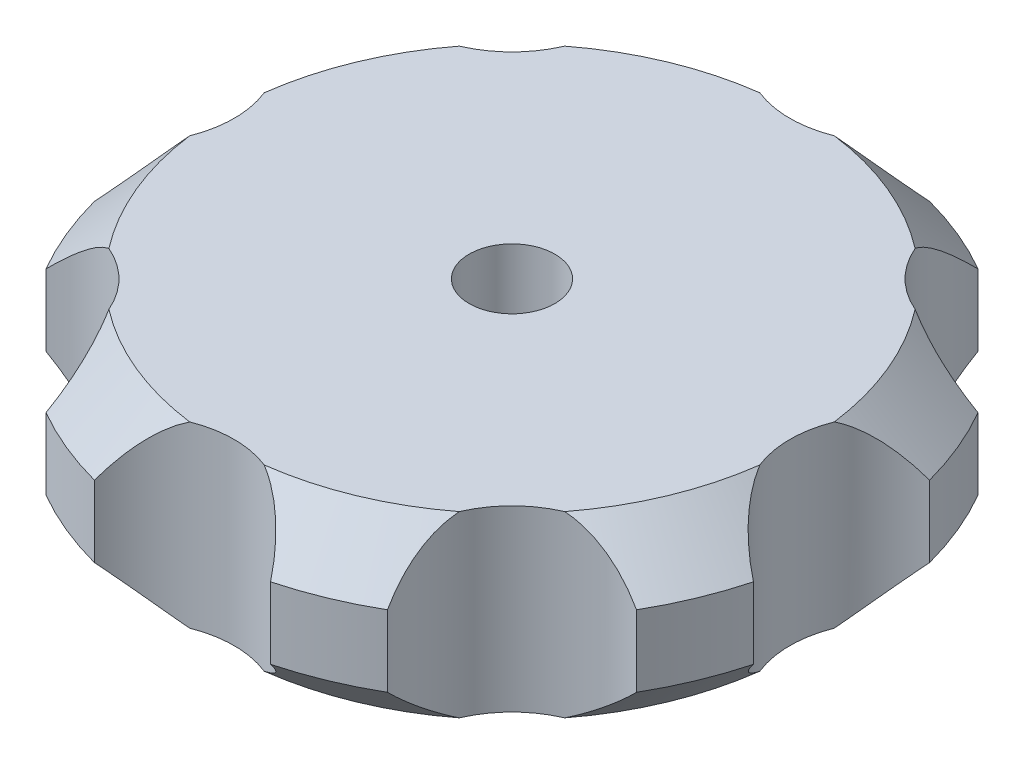
from build123d import *

# Parameters (mm, degrees)
BOSS_EXTRUDE1_DEPTH  = 10
CHAMFER1_SIZE        = 3
M4_CLEARANCE_HOLE1_D = 4.8


with BuildPart() as part:
    # Sketch1 → Boss-Extrude1 (new body)
    with BuildSketch(Plane(origin=(0, 0, 0), x_dir=(1, 0, 0), z_dir=(0, 1, 0))):
        with BuildLine():
            ThreePointArc((4.929173178, -18.444040543), (0, -15.55551692), (-4.929173178, -18.444040543))
            ThreePointArc((-4.929173178, -18.444040543), (-7.30594069, -17.6381011), (-9.556454361, -16.527357921))
            ThreePointArc((-9.556454361, -16.527357921), (-10.999411499, -10.999411499), (-16.527357921, -9.556454361))
            ThreePointArc((-16.527357921, -9.556454361), (-17.6381011, -7.30594069), (-18.444040543, -4.929173178))
            ThreePointArc((-18.444040543, -4.929173178), (-15.55551692, 0), (-18.444040543, 4.929173178))
            ThreePointArc((-18.444040543, 4.929173178), (-17.6381011, 7.30594069), (-16.527357921, 9.556454361))
            ThreePointArc((-16.527357921, 9.556454361), (-10.999411499, 10.999411499), (-9.556454361, 16.527357921))
            ThreePointArc((-9.556454361, 16.527357921), (-7.30594069, 17.6381011), (-4.929173178, 18.444040543))
            ThreePointArc((-4.929173178, 18.444040543), (0, 15.55551692), (4.929173178, 18.444040543))
            ThreePointArc((4.929173178, 18.444040543), (7.30594069, 17.6381011), (9.556454361, 16.527357921))
            ThreePointArc((9.556454361, 16.527357921), (10.999411499, 10.999411499), (16.527357921, 9.556454361))
            ThreePointArc((16.527357921, 9.556454361), (17.6381011, 7.30594069), (18.444040543, 4.929173178))
            ThreePointArc((18.444040543, 4.929173178), (15.55551692, 0), (18.444040543, -4.929173178))
            ThreePointArc((18.444040543, -4.929173178), (17.6381011, -7.30594069), (16.527357921, -9.556454361))
            ThreePointArc((16.527357921, -9.556454361), (10.999411499, -10.999411499), (9.556454361, -16.527357921))
            ThreePointArc((9.556454361, -16.527357921), (7.30594069, -17.6381011), (4.929173178, -18.444040543))
        make_face()
    extrude(amount=BOSS_EXTRUDE1_DEPTH)

    # Chamfer1
    chamfer1_edges = [part.edges().sort_by_distance(p)[0] for p in [
        (-7.30594069, 0, -17.6381011),
        (7.30594069, 0, -17.6381011),
        (17.6381011, 0, -7.30594069),
        (17.6381011, 0, 7.30594069),
        (7.30594069, 0, 17.6381011),
        (-7.30594069, 0, 17.6381011),
        (-17.6381011, 0, 7.30594069),
        (-17.6381011, 0, -7.30594069),
        (-17.6381011, 10, -7.30594069),
        (-7.30594069, 10, -17.6381011),
        (7.30594069, 10, -17.6381011),
        (17.6381011, 10, -7.30594069),
        (17.6381011, 10, 7.30594069),
        (7.30594069, 10, 17.6381011),
        (-7.30594069, 10, 17.6381011),
        (-17.6381011, 10, 7.30594069),
    ]]
    chamfer(chamfer1_edges, length=CHAMFER1_SIZE)

    # M4 Clearance Hole1 (through all)
    with Locations(Plane(origin=(0, 10, 0), x_dir=(1, 0, 0), z_dir=(0, 1, 0))):
        with Locations((0, 0)):
            Hole(M4_CLEARANCE_HOLE1_D / 2)


solid = part.part
